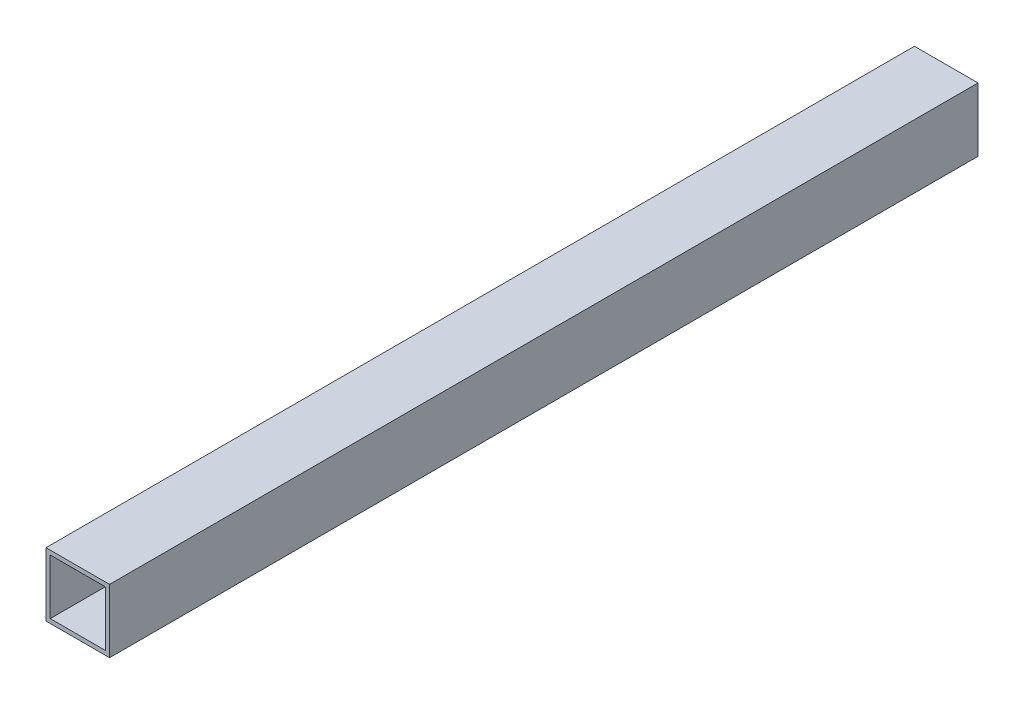
from build123d import *

# Parameters (mm, degrees)
SKETCH_1_W      = 15
SKETCH_1_H      = 15
SKETCH_1_W_2    = 13
SKETCH_1_H_2    = 13
EXTRUDE_1_DEPTH = 205


with BuildPart() as part:
    # 草图1 → 拉伸-薄壁1 (new body)
    with BuildSketch(Plane.XY):
        with Locations((7.5, -7.5)):
            Rectangle(SKETCH_1_W, SKETCH_1_H)
        with Locations((7.5, -7.5)):
            Rectangle(SKETCH_1_W_2, SKETCH_1_H_2, mode=Mode.SUBTRACT)
    extrude(amount=EXTRUDE_1_DEPTH)


solid = part.part
